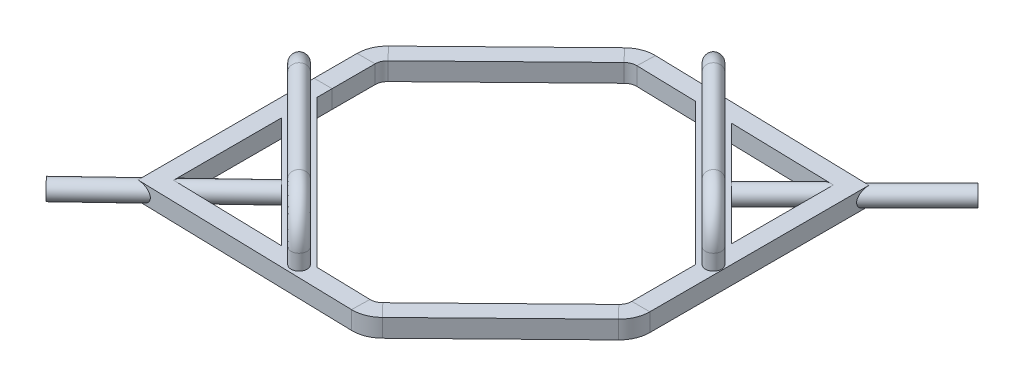
from build123d import *

# Parameters (mm, degrees)
SWEEP1_START        = -15.278234842
SWEEP1_DEPTH        = 30.556469684
SKETCH6_R           = 13.600984241
SKETCH8_W           = 42.677063854
SKETCH8_H           = 30.556469684
SKETCH9_R           = 15.278234842
BOSS_EXTRUDE1_DEPTH = 131.572
SKETCH10_R          = 15.08646221
BOSS_EXTRUDE2_DEPTH = 162.052
SKETCH11_R          = 15.278234842
BOSS_EXTRUDE3_DEPTH = 296.164
BOSS_EXTRUDE4_REACH = 754.5
BOSS_EXTRUDE5_REACH = 752.76
SKETCH13_W          = 5.310182484
SKETCH13_H          = 30.556469684
SCALE1_SCALE        = 1.5


# Read off the part's stored shape, not the designer's step: Sweep1
with BuildPart() as part:
    # Sweep1 outline → Sweep1 (new body)
    with BuildSketch(Plane(origin=(0, 0, 0), x_dir=(1, 0, 0), z_dir=(0, 1, 0)).offset(SWEEP1_START)):
        with BuildLine():
            Line((-306.148893999, 72.889739207), (-306.148893999, -298.501465503))
            Line((-306.148893999, -298.501465503), (65.123511279, -307.894442395))
            ThreePointArc((65.123511279, -307.894442395), (85.479114327, -304.311825152), (102.843694212, -293.102137949))
            Line((102.843694212, -293.102137949), (305.372800707, -95.632095493))
            ThreePointArc((305.372800707, -95.632095493), (317.018075483, -78.556578014), (321.114366969, -58.2980954))
            Line((321.114366969, -58.2980954), (321.114366969, 313.093109311))
            Line((321.114366969, 313.093109311), (-50.15803831, 322.486086202))
            ThreePointArc((-50.15803831, 322.486086202), (-70.513641359, 318.90346896), (-87.878221243, 307.693781756))
            Line((-87.878221243, 307.693781756), (-290.407327738, 110.2237393))
            ThreePointArc((-290.407327738, 110.2237393), (-302.052602513, 93.148221821), (-306.148893999, 72.889739207))
        make_face()
        with BuildLine():
            Line((-275.592424315, -268.708279376), (-275.592424315, 72.889739207))
            ThreePointArc((-275.592424315, 72.889739207), (-273.896613149, 81.276486376), (-269.075621512, 88.345527557))
            Line((-269.075621512, 88.345527557), (-66.546515017, 285.815570013))
            ThreePointArc((-66.546515017, 285.815570013), (-59.357805776, 290.456234084), (-50.930852017, 291.939390823))
            Line((-50.930852017, 291.939390823), (290.557897284, 283.299923184))
            Line((290.557897284, 283.299923184), (290.557897284, -58.2980954))
            ThreePointArc((290.557897284, -58.2980954), (288.862086118, -66.684842568), (284.041094482, -73.753883749))
            Line((284.041094482, -73.753883749), (81.511987987, -271.223926205))
            ThreePointArc((81.511987987, -271.223926205), (74.323278746, -275.864590277), (65.896324986, -277.347747016))
            Line((65.896324986, -277.347747016), (-275.592424315, -268.708279376))
        make_face(mode=Mode.SUBTRACT)
    extrude(amount=SWEEP1_DEPTH)

    # Sweep2: sweep along a path in Sketch5
    with BuildLine(Plane(origin=(185.347659395, 0, -185.347659395), x_dir=(0.7071067811865562, 0, 0.7071067811865388), z_dir=(-0.7071067811865388, 0, 0.7071067811865562))) as sweep2_path:
        Line((170.396432247, 0), (170.396432247, 41.52665431))
        ThreePointArc((170.396432247, 41.52665431), (153.285610404, 82.835832467), (111.976432247, 99.94665431))
        Line((111.976432247, 99.94665431), (-109.737604983, 99.94665431))
        ThreePointArc((-109.737604983, 99.94665431), (-151.046783139, 82.835832467), (-168.157604983, 41.52665431))
        Line((-168.157604983, 41.52665431), (-168.157604983, 0))
    # Sketch6 → Sweep2 (sweep)
    with BuildSketch(Plane(origin=(0, 0, 0), x_dir=(1, 0, 0), z_dir=(0, 1, 0))):
        with Locations((66.442276603, 304.253042186)):
            Circle(SKETCH6_R)
    sweep2 = sweep(path=sweep2_path.line)

    # Sweep3: sweep along a path in Sketch7
    with BuildLine(Plane(origin=(185.347659395, 0, -185.347659395), x_dir=(0.7071067811865562, 0, 0.7071067811865388), z_dir=(-0.7071067811865388, 0, 0.7071067811865562))) as sweep3_path:
        Line((-168.157604983, 0), (170.396432247, 0))
    # Sketch8 → Sweep3 (sweep)
    with BuildSketch(Plane(origin=(-119.696927762, 0, -122.763491253), x_dir=(0.7159927821962476, 0, -0.6981076821256709), z_dir=(0.6981076821256709, 0, 0.7159927821962476))):
        with Locations((259.973576541, 0)):
            Rectangle(SKETCH8_W, SKETCH8_H)
    sweep3 = sweep(path=sweep3_path.line)

    # Sketch9 → Boss-Extrude1 (add)
    with BuildSketch(Plane(origin=(200.435073348, 0, -200.435073348), x_dir=(-0.7071067811865562, -4.438233130955744e-13, -0.7071067811865388), z_dir=(0.7071067811865388, -4.438233130955853e-13, -0.7071067811865562))):
        with Locations(Location((-2.528524686, 0, 0), (0, 0, 90))):
            Circle(SKETCH9_R)
    extrude(amount=BOSS_EXTRUDE1_DEPTH)

    # Sketch10 → Boss-Extrude2 (add)
    with BuildSketch(Plane(origin=(294.906784072, 0, -294.906784072), x_dir=(0.7071067811865562, 0, 0.7071067811865388), z_dir=(-0.7071067811865388, 0, 0.7071067811865562))):
        with Locations((5.402024194, 0)):
            Circle(SKETCH10_R)
    extrude(amount=-BOSS_EXTRUDE2_DEPTH)

    # Sketch11 → Boss-Extrude3 (add)
    with BuildSketch(Plane(origin=(-174.828459041, 0, 166.200620773), x_dir=(0.6889969243726892, 0, 0.7247642638851441), z_dir=(-0.7247642638851441, 0, 0.6889969243726892))):
        with Locations(Location((5.382894592, 0, 0), (0, 0, 268.068044215))):
            Circle(SKETCH11_R)
    extrude(amount=BOSS_EXTRUDE3_DEPTH)

    # Mirror1: Sweep2, Sweep3 across plane
    add(sweep2.mirror(Plane(origin=(9.771366639, 0, -9.771366639), x_dir=(0.7071067811865562, 0, 0.7071067811865388), z_dir=(-0.7071067811865388, 0, 0.7071067811865562))))
    add(sweep3.mirror(Plane(origin=(9.771366639, 0, -9.771366639), x_dir=(0.7071067811865562, 0, 0.7071067811865388), z_dir=(-0.7071067811865388, 0, 0.7071067811865562))))

    # Sketch12 → Boss-Extrude4 (add, up to next)
    with BuildSketch(Plane(origin=(-122.513234778, 0, -119.452922553), x_dir=(-0.6981076821256531, 1.4154863240378708e-15, 0.715992782196265), z_dir=(-0.715992782196265, 1.4517502346095406e-15, -0.6981076821256531)), mode=Mode.PRIVATE) as boss_extrude4_sk1:
        Polygon((219.277331358, -15.278234842), (219.277331358, 0), (218.737204096, 0), (218.737204096, 15.278234842), (210.99965641, 15.278234842), (210.99965641, -15.278234842), align=None)
    boss_extrude4_tool1 = extrude(boss_extrude4_sk1.sketch, amount=BOSS_EXTRUDE4_REACH, mode=Mode.PRIVATE) - part.part
    add(boss_extrude4_tool1.solids().sort_by_distance((-272.611983, -0.257636, 34.491265))[0])

    # Sketch13 → Boss-Extrude5 (add, up to next)
    with BuildSketch(Plane(origin=(119.869626773, 0, 116.875350401), x_dir=(0.6981076821256531, -1.4154863240378708e-15, -0.715992782196265), z_dir=(0.715992782196265, -1.4517502346095406e-15, 0.6981076821256531)), mode=Mode.PRIVATE) as boss_extrude5_sk1:
        with Locations((-217.936330715, 0)):
            Rectangle(SKETCH13_W, SKETCH13_H)
    boss_extrude5_tool1 = extrude(boss_extrude5_sk1.sketch, amount=BOSS_EXTRUDE5_REACH, mode=Mode.PRIVATE) - part.part
    add(boss_extrude5_tool1.solids().sort_by_distance((-32.2734, 0, 272.91619))[0])


with BuildPart() as part_1:
    # Scale1: scaled about (8.702201295, 12.173569048, -8.333178584)
    add(part.part.scale(SCALE1_SCALE).moved(Location((-4.351100648, -6.086784524, 4.166589292))))


solid = part_1.part
